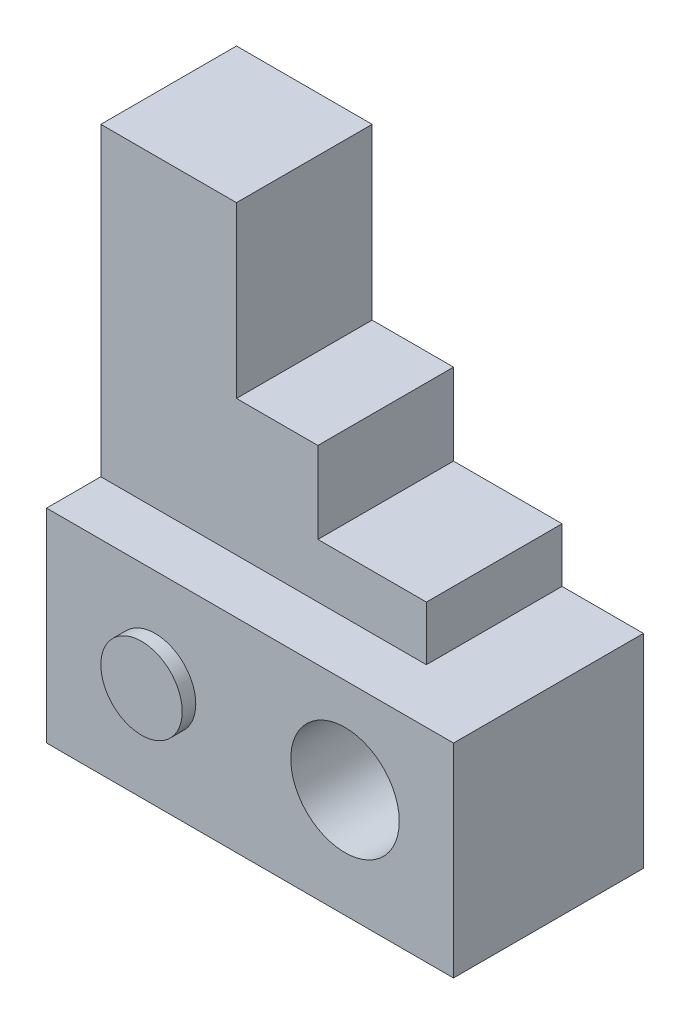
from build123d import *

# Parameters (mm, degrees)
SKETCH1_W           = 60
SKETCH1_H           = 30
SKETCH1_R           = 8
BOSS_EXTRUDE1_DEPTH = 28
BOSS_EXTRUDE2_DEPTH = 20
SKETCH3_R           = 6
BOSS_EXTRUDE3_DEPTH = 2


with BuildPart() as part:
    # Sketch1 → Boss-Extrude1 (new body)
    with BuildSketch(Plane.XY):
        with Locations((30, 15)):
            Rectangle(SKETCH1_W, SKETCH1_H)
        with Locations((44, 16)):
            Circle(SKETCH1_R, mode=Mode.SUBTRACT)
    extrude(amount=BOSS_EXTRUDE1_DEPTH)

    # Sketch2 → Boss-Extrude2 (add)
    with BuildSketch(Plane.XY):
        Polygon((0, 30), (0, 75), (20, 75), (20, 50), (32, 50), (32, 38), (48, 38), (48, 30), align=None)
    extrude(amount=BOSS_EXTRUDE2_DEPTH)

    # Sketch3 → Boss-Extrude3 (add)
    with BuildSketch(Plane.XY.offset(28)):
        with Locations((16, 16)):
            Circle(SKETCH3_R)
    extrude(amount=BOSS_EXTRUDE3_DEPTH)


solid = part.part
